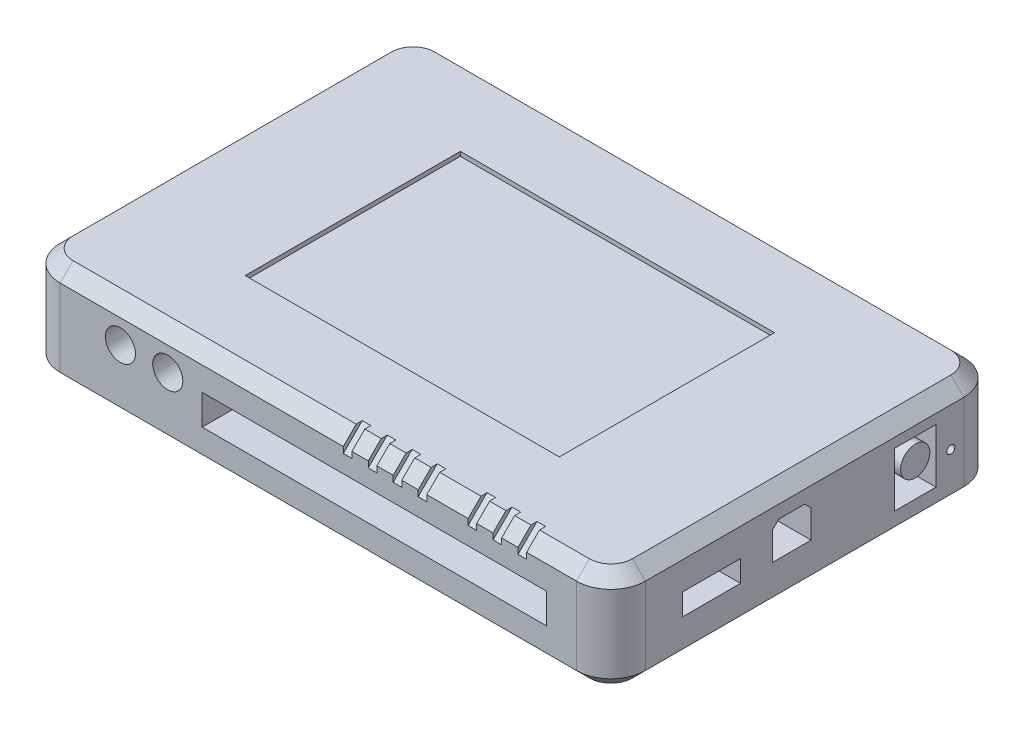
from build123d import *

# Parameters (mm, degrees)
SKETCH1_W           = 136
SKETCH1_H           = 90
BOSS_EXTRUDE1_DEPTH = 24
SKETCH4_R           = 0.930895073
SKETCH4_W           = 13.5
SKETCH4_H           = 5
SKETCH4_W_2         = 9.671745291
SKETCH4_H_2         = 12.631347156
SKETCH4_R_2         = 3.3980858
CUT_EXTRUDE1_DEPTH  = 10
SKETCH3_W           = 50
SKETCH3_H           = 9
CUT_EXTRUDE2_DEPTH  = 10
SKETCH2_R           = 3.5
SKETCH2_W           = 80
SKETCH2_H           = 7
CUT_EXTRUDE3_DEPTH  = 10
FILLET1_R           = 8
CHAMFER1_SIZE       = 3
CUT_EXTRUDE4_DEPTH  = 5
CUT_EXTRUDE5_START  = 73.8
CUT_EXTRUDE5_DEPTH  = 2
LPATTERN1_COUNT     = 8
LPATTERN1_PITCH     = 5.8
SKETCH7_W           = 73
SKETCH7_H           = 50
CUT_EXTRUDE6_DEPTH  = 1


# Read off the part's stored shape, not the designer's step: Cut-Extrude5
with BuildPart() as part:
    # Sketch1 → Boss-Extrude1 (new body)
    with BuildSketch(Plane(origin=(0, 0, 0), x_dir=(1, 0, 0), z_dir=(0, 1, 0))):
        with Locations((68, 45)):
            Rectangle(SKETCH1_W, SKETCH1_H)
    extrude(amount=BOSS_EXTRUDE1_DEPTH)

    # Sketch4 → Cut-Extrude1 (cut)
    # profile 1 of 4: a face of its own
    with BuildSketch(Plane(origin=(136, 0, 0), x_dir=(0, 0, -1), z_dir=(1, 0, 0))):
        with Locations((78.971843902, 12)):
            Circle(SKETCH4_R)
    # profile 2 of 4: a face of its own
    with BuildSketch(Plane(origin=(136, 0, 0), x_dir=(0, 0, -1), z_dir=(1, 0, 0))):
        Polygon((37.51037714, 10), (37.51037714, 16.5), (39.01037714, 18), (45.01037714, 18), (46.51037714, 16.5), (46.51037714, 10), align=None)
    # profile 3 of 4: a face of its own
    with BuildSketch(Plane(origin=(136, 0, 0), x_dir=(0, 0, -1), z_dir=(1, 0, 0))):
        with Locations((23.357700282, 12)):
            Rectangle(SKETCH4_W, SKETCH4_H)
    # profile 4 of 4: a face of its own
    with BuildSketch(Plane(origin=(136, 0, 0), x_dir=(0, 0, -1), z_dir=(1, 0, 0))):
        with Locations((70.687922275, 12.465761788)):
            Rectangle(SKETCH4_W_2, SKETCH4_H_2)
        with Locations((70.707468534, 13.819380659)):
            Circle(SKETCH4_R_2, mode=Mode.SUBTRACT)
    extrude(amount=-CUT_EXTRUDE1_DEPTH, mode=Mode.SUBTRACT)

    # Sketch3 → Cut-Extrude2 (cut)
    with BuildSketch(Plane(origin=(0, 0, -90), x_dir=(-1, 0, 0), z_dir=(0, 0, -1))):
        with Locations((-38, 12)):
            Rectangle(SKETCH3_W, SKETCH3_H)
        with Locations((-98, 12)):
            Rectangle(SKETCH3_W, SKETCH3_H)
    extrude(amount=-CUT_EXTRUDE2_DEPTH, mode=Mode.SUBTRACT)

    # Sketch2 → Cut-Extrude3 (cut)
    with BuildSketch(Plane.XY):
        with Locations((33, 15.5)):
            Circle(SKETCH2_R)
        with Locations((22, 15.5)):
            Circle(SKETCH2_R)
        with Locations((81, 12)):
            Rectangle(SKETCH2_W, SKETCH2_H)
    extrude(amount=-CUT_EXTRUDE3_DEPTH, mode=Mode.SUBTRACT)

    # Fillet1
    fillet1_edges = [part.edges().sort_by_distance(p)[0] for p in [
        (0, 12, -90),
        (136, 12, -90),
        (136, 12, 0),
        (0, 12, 0),
    ]]
    fillet(fillet1_edges, radius=FILLET1_R)

    # Chamfer1
    chamfer1_edges = [part.edges().sort_by_distance(p)[0] for p in [
        (0, 0, -45),
        (0, 24, -45),
        (68, 0, -90),
        (136, 0, -45),
        (68, 0, 0),
        (133.656854249, 0, -87.656854249),
        (133.656854249, 0, -2.343145751),
        (2.343145751, 0, -2.343145751),
        (2.343145751, 0, -87.656854249),
        (68, 24, -90),
        (68, 24, 0),
        (136, 24, -45),
        (133.656854249, 24, -87.656854249),
        (133.656854249, 24, -2.343145751),
        (2.343145751, 24, -2.343145751),
        (2.343145751, 24, -87.656854249),
    ]]
    chamfer(chamfer1_edges, length=CHAMFER1_SIZE)

    # Sketch5 → Cut-Extrude4 (cut)
    with BuildSketch(Plane.XZ):
        with BuildLine():
            Line((32.8, -43), (27.264101615, -43))
            ThreePointArc((27.264101615, -43), (19.8, -45), (27.264101615, -47))
            Line((27.264101615, -47), (32.8, -47))
            ThreePointArc((32.8, -47), (34.8, -45), (32.8, -43))
        make_face()
        with BuildLine():
            Line((112.8, -24.9), (107.264101615, -24.9))
            ThreePointArc((107.264101615, -24.9), (99.8, -22.9), (107.264101615, -20.9))
            Line((107.264101615, -20.9), (112.8, -20.9))
            ThreePointArc((112.8, -20.9), (114.8, -22.9), (112.8, -24.9))
        make_face()
        with BuildLine():
            Line((112.8, -65.1), (107.264101615, -65.1))
            ThreePointArc((107.264101615, -65.1), (99.8, -67.1), (107.264101615, -69.1))
            Line((107.264101615, -69.1), (112.8, -69.1))
            ThreePointArc((112.8, -69.1), (114.8, -67.1), (112.8, -65.1))
        make_face()
    extrude(amount=-CUT_EXTRUDE4_DEPTH, mode=Mode.SUBTRACT)

    # Cut-Extrude5 outline → Cut-Extrude5 (cut)
    with BuildSketch(Plane.YZ.offset(CUT_EXTRUDE5_START)):
        Polygon((21, 0), (19.585786438, 0), (24, -4.414213562), (24, -3), align=None)
    cut_extrude5 = extrude(amount=CUT_EXTRUDE5_DEPTH, mode=Mode.SUBTRACT)

    # LPattern1: Cut-Extrude5 ×8, 1 skipped
    with Locations(*[(i * LPATTERN1_PITCH, 0, 0) for i in range(1, LPATTERN1_COUNT) if i not in (4,)]):
        add(cut_extrude5, mode=Mode.SUBTRACT)

    # Sketch7 → Cut-Extrude6 (cut)
    with BuildSketch(Plane(origin=(0, 24, 0), x_dir=(1, 0, 0), z_dir=(0, 1, 0))):
        with Locations((67.5, 45)):
            Rectangle(SKETCH7_W, SKETCH7_H)
    extrude(amount=-CUT_EXTRUDE6_DEPTH, mode=Mode.SUBTRACT)


solid = part.part
